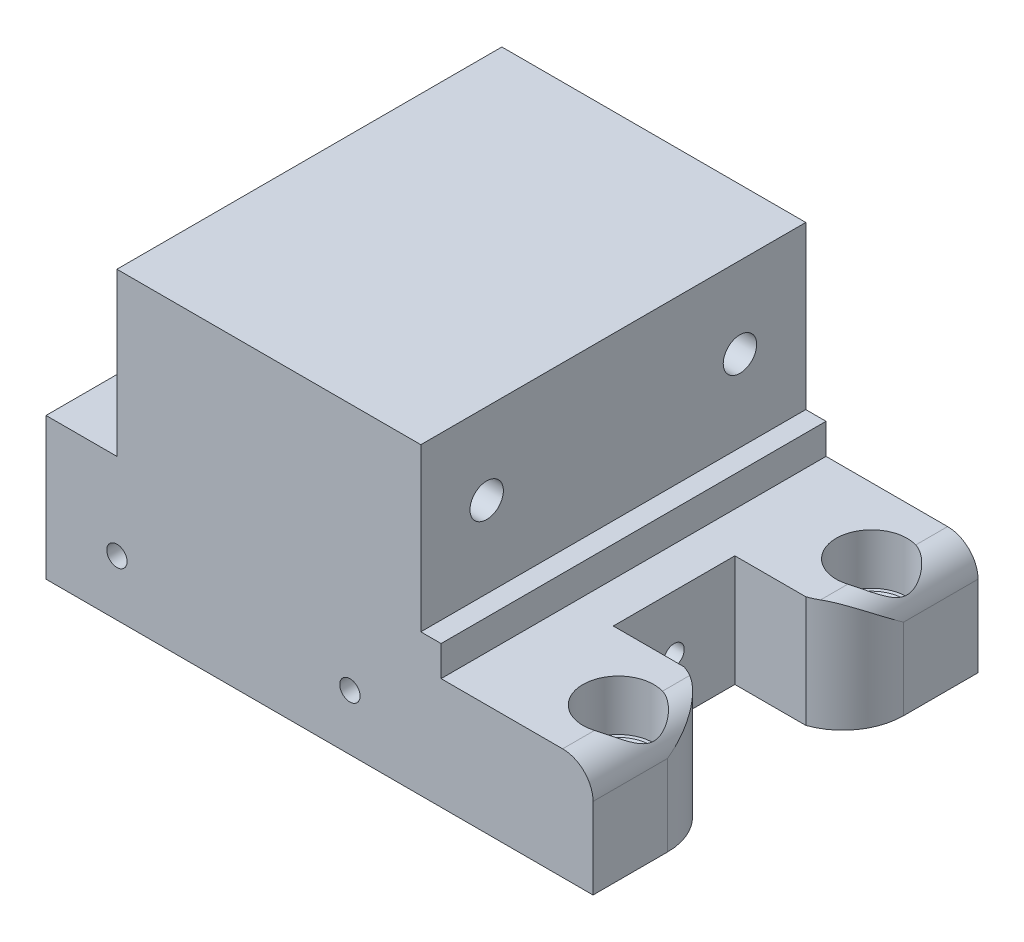
from build123d import *

# Parameters (mm, degrees)
SKETCH_28_R                  = 1
EXTRUDE_4469_DEPTH           = 38
CUT_EXTRUDE_4687_REACH       = 69.476
SKETCH_29_R                  = 1.65
CUT_EXTRUDE_4925_DEPTH       = 51.338851795
FILLET_9_R                   = 3
SKETCH_31_R                  = 1
CUT_EXTRUDE_5310_DEPTH       = 11
SKETCH_32_R                  = 3.5
CUT_EXTRUDE_5556_DEPTH       = 5
HOLE_WIZARD_5601_D           = 3.4
HOLE_WIZARD_5601_CSINK_D     = 6.3
HOLE_WIZARD_5601_CSINK_ANGLE = 90


with BuildPart() as part:
    # Эскиз28 → Extrude 4469 (new body)
    with BuildSketch(Plane.XY):
        Polygon((27, 0), (27, 11), (12, 11), (12, 14), (10, 14), (10, 30), (-20, 30), (-20, 14), (-27, 14), (-27, 11), (-27, 0), align=None)
        with Locations((3, 5.5)):
            Circle(SKETCH_28_R, mode=Mode.SUBTRACT)
        with Locations((-20, 5.5)):
            Circle(SKETCH_28_R, mode=Mode.SUBTRACT)
    extrude(amount=EXTRUDE_4469_DEPTH)

    # Эскиз29 → Cut-Extrude 4687 (cut, up to next)
    with BuildSketch(Plane.ZY.offset(20), mode=Mode.PRIVATE) as cut_extrude_4687_sk1:
        with Locations((6.5, 22)):
            Circle(SKETCH_29_R)
    cut_extrude_4687_tool1 = extrude(cut_extrude_4687_sk1.sketch, amount=-CUT_EXTRUDE_4687_REACH, mode=Mode.PRIVATE) & part.part
    # Эскиз29 → Cut-Extrude 4687 (cut, up to next)
    with BuildSketch(Plane.ZY.offset(20), mode=Mode.PRIVATE) as cut_extrude_4687_sk2:
        with Locations((31.5, 22)):
            Circle(SKETCH_29_R)
    cut_extrude_4687_tool2 = extrude(cut_extrude_4687_sk2.sketch, amount=-CUT_EXTRUDE_4687_REACH, mode=Mode.PRIVATE) & part.part
    add(cut_extrude_4687_tool1.solids().sort_by_distance((-20, 22, 6.5))[0], mode=Mode.SUBTRACT)
    add(cut_extrude_4687_tool2.solids().sort_by_distance((-20, 22, 31.5))[0], mode=Mode.SUBTRACT)

    # Эскиз30 → Cut-Extrude 4925 (cut, through all)
    with BuildSketch(Plane(origin=(0, 11, 0), x_dir=(1, 0, 0), z_dir=(0, 1, 0))):
        with BuildLine():
            Line((23, -13), (16, -13))
            Line((16, -13), (16, -25))
            Line((16, -25), (23, -25))
            ThreePointArc((23, -25), (25.898979486, -27.192752634), (27, -30.656854249))
            Line((27, -30.656854249), (27, -7.343145751))
            ThreePointArc((27, -7.343145751), (25.898979486, -10.807247366), (23, -13))
        make_face()
    extrude(amount=-CUT_EXTRUDE_4925_DEPTH, mode=Mode.SUBTRACT)

    # Скругление9
    # the kernel refuses this fillet: 3 mm, written as the material it takes off along each edge
    with BuildSketch(Plane(origin=(27, 11, 23.156854249), x_dir=(-1, 0, 0), z_dir=(0, 0, 1))) as fillet_9_piece_1:
        with BuildLine():
            CenterArc((FILLET_9_R, FILLET_9_R), FILLET_9_R, 180, 90)
            Line((0, FILLET_9_R), (0, 0))
            Line((0, 0), (FILLET_9_R, 0))
        make_face()
    extrude(amount=22.343145751, mode=Mode.SUBTRACT)
    with BuildSketch(Plane(origin=(27, 11, -7.5), x_dir=(0, -1, 0), z_dir=(0, 0, 1))) as fillet_9_piece_2:
        with BuildLine():
            CenterArc((FILLET_9_R, -FILLET_9_R), FILLET_9_R, 90, 90)
            Line((0, -FILLET_9_R), (0, 0))
            Line((0, 0), (FILLET_9_R, 0))
        make_face()
    extrude(amount=22.343145751, mode=Mode.SUBTRACT)

    # Эскиз31 → Cut-Extrude 5310 (cut)
    with BuildSketch(Plane(origin=(16, 0, 0), x_dir=(0, 0, -1), z_dir=(1, 0, 0))):
        with Locations(Location((-19, 5.5, 0), (0, 0, 90))):
            Circle(SKETCH_31_R)
    extrude(amount=-CUT_EXTRUDE_5310_DEPTH, mode=Mode.SUBTRACT)

    # Эскиз32 → Cut-Extrude 5556 (cut)
    with BuildSketch(Plane(origin=(0, 11, 0), x_dir=(1, 0, 0), z_dir=(0, 1, 0))):
        with Locations(Location((23, -6.5, 0), (0, 0, 180))):
            Circle(SKETCH_32_R)
        with Locations(Location((23, -31.5, 0), (0, 0, 73.398450401))):
            Circle(SKETCH_32_R)
    extrude(amount=-CUT_EXTRUDE_5556_DEPTH, mode=Mode.SUBTRACT)

    # Hole Wizard 5601 (through all)
    with Locations(Plane(origin=(0, 6, 0), x_dir=(1, 0, 0), z_dir=(0, 1, 0))):
        with Locations((23, -6.5), (23, -31.5)):
            CounterSinkHole(HOLE_WIZARD_5601_D / 2, HOLE_WIZARD_5601_CSINK_D / 2, counter_sink_angle=HOLE_WIZARD_5601_CSINK_ANGLE)


solid = part.part
